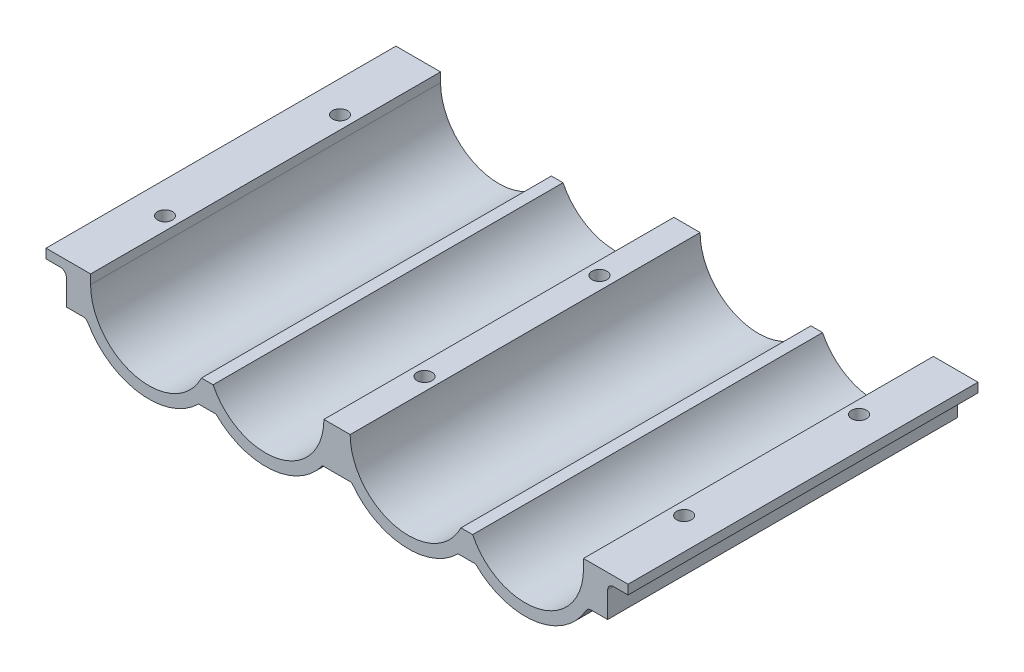
from build123d import *

# Parameters (mm, degrees)
BOSS_EXTRUDE1_DEPTH                         = 60
FILLET1_R                                   = 1
TAPPED_START                                = -7
TAPPED_HOLE_FOR_M2_5X0_45_HELICOIL1_OUTL_R  = 1.275
TAPPED_HOLE_FOR_M2_5X0_45_HELICOIL1_DEPTH   = 7
TAPPED_START_2                              = -8.6
TAPPED_HOLE_FOR_M2_5X0_45_HELICOIL1_2_OU_R  = 1.275
TAPPED_HOLE_FOR_M2_5X0_45_HELICOIL1_2_DEPTH = 1.6


# Read off the part's stored shape, not the designer's step: Tapped Hole for M2.5x0.45 Helicoil1
with BuildPart() as part:
    # Sketch1 → Boss-Extrude1 (new body)
    with BuildSketch(Plane.XY):
        with BuildLine():
            Line((0, 0), (7.65, 0))
            Line((7.65, 0), (7.65, -1.6))
            ThreePointArc((7.65, -1.6), (15.413932023, -11.346794345), (26.65, -5.958898944))
            Line((26.65, -5.958898944), (28.65, -5.958898944))
            ThreePointArc((28.65, -5.958898944), (39.886067977, -11.346794345), (47.65, -1.6))
            Line((47.65, -1.6), (52.15, -1.6))
            ThreePointArc((52.15, -1.6), (59.913932023, -11.346794345), (71.15, -5.958898944))
            Line((71.15, -5.958898944), (73.15, -5.958898944))
            ThreePointArc((73.15, -5.958898944), (84.386067977, -11.346794345), (92.15, -1.6))
            Line((92.15, -1.6), (92.15, 0))
            Line((92.15, 0), (99.8, 0))
            Line((99.8, 0), (99.8, -1.6))
            Line((99.8, -1.6), (96.3, -1.6))
            Line((96.3, -1.6), (96.3, -7))
            Line((96.3, -7), (92.86634266, -7))
            ThreePointArc((92.86634266, -7), (84.043434268, -13.449679602), (73.65, -10.070537173))
            Line((73.65, -10.070537173), (70.65, -10.070537173))
            ThreePointArc((70.65, -10.070537173), (61.186027008, -13.561218837), (52.403205655, -8.6))
            Line((52.403205655, -8.6), (47.396794345, -8.6))
            ThreePointArc((47.396794345, -8.6), (38.613972992, -13.561218837), (29.15, -10.070537173))
            Line((29.15, -10.070537173), (26.15, -10.070537173))
            ThreePointArc((26.15, -10.070537173), (15.756565732, -13.449679602), (6.93365734, -7))
            Line((6.93365734, -7), (3.5, -7))
            Line((3.5, -7), (3.5, -1.6))
            Line((3.5, -1.6), (0, -1.6))
            Line((0, -1.6), (0, 0))
        make_face()
    extrude(amount=BOSS_EXTRUDE1_DEPTH)

    # Fillet1
    fillet1_edges = [part.edges().sort_by_distance(p)[0] for p in [
        (96.3, -1.6, 30),
        (92.86634266, -7, 30),
        (6.93365734, -7, 30),
        (3.5, -1.6, 30),
    ]]
    fillet(fillet1_edges, radius=FILLET1_R)

    # Tapped Hole for M2.5x0.45 Helicoil1 outl → Tapped Hole for M2.5x0.45 Helicoil1 (cut)
    with BuildSketch(Plane(origin=(0, 0, 0), x_dir=(1, 0, 0), z_dir=(0, 1, 0)).offset(TAPPED_START)):
        with Locations((94.4, -15)):
            Circle(TAPPED_HOLE_FOR_M2_5X0_45_HELICOIL1_OUTL_R)
        with Locations((94.4, -45)):
            Circle(TAPPED_HOLE_FOR_M2_5X0_45_HELICOIL1_OUTL_R)
        with Locations((49.9, -15)):
            Circle(TAPPED_HOLE_FOR_M2_5X0_45_HELICOIL1_OUTL_R)
        with Locations((49.9, -45)):
            Circle(TAPPED_HOLE_FOR_M2_5X0_45_HELICOIL1_OUTL_R)
    tapped_hole_for_m2_5x0_45_helicoil1 = extrude(amount=TAPPED_HOLE_FOR_M2_5X0_45_HELICOIL1_DEPTH, mode=Mode.SUBTRACT)

    # Tapped Hole for M2.5x0.45 Helicoil1 2 ou → Tapped Hole for M2.5x0.45 Helicoil1 2 (cut)
    with BuildSketch(Plane(origin=(0, 0, 0), x_dir=(1, 0, 0), z_dir=(0, 1, 0)).offset(TAPPED_START_2)):
        with Locations((49.9, -15)):
            Circle(TAPPED_HOLE_FOR_M2_5X0_45_HELICOIL1_2_OU_R)
        with Locations((49.9, -45)):
            Circle(TAPPED_HOLE_FOR_M2_5X0_45_HELICOIL1_2_OU_R)
    tapped_hole_for_m2_5x0_45_helicoil1_2 = extrude(amount=TAPPED_HOLE_FOR_M2_5X0_45_HELICOIL1_2_DEPTH, mode=Mode.SUBTRACT)

    # Mirror1: Tapped Hole for M2.5x0.45 Helicoil1, Tapped Hole for M2.5x0.45 Helicoil1 2 across plane
    add(tapped_hole_for_m2_5x0_45_helicoil1.mirror(Plane.ZY.offset(-49.9)), mode=Mode.SUBTRACT)
    add(tapped_hole_for_m2_5x0_45_helicoil1_2.mirror(Plane.ZY.offset(-49.9)), mode=Mode.SUBTRACT)


solid = part.part
